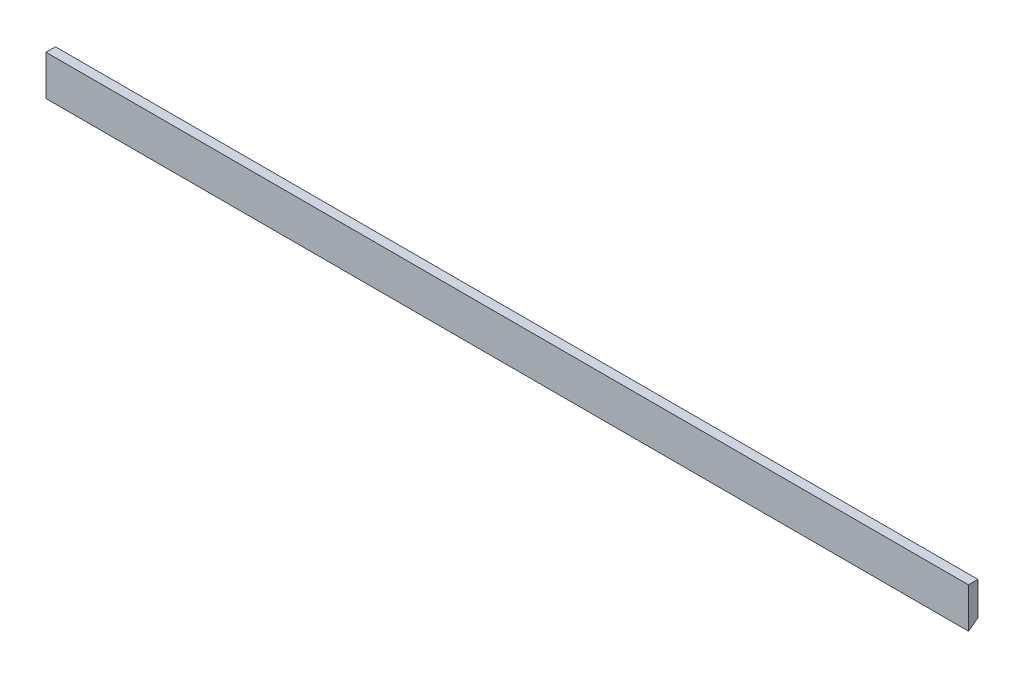
from build123d import *

# Parameters (mm, degrees)
SKETCH2_W           = 3.175
SKETCH2_H           = 13.49
BOSS_EXTRUDE1_DEPTH = 310
CHAMFER1_SIZE       = 2.349376413
CHAMFER1_SIZE_2     = 3.175


with BuildPart() as part:
    # Sketch2 → Boss-Extrude1 (new body)
    with BuildSketch(Plane(origin=(0, 0, 0), x_dir=(0, 0, -1), z_dir=(1, 0, 0))):
        Rectangle(SKETCH2_W, SKETCH2_H)
    extrude(amount=BOSS_EXTRUDE1_DEPTH)

    # Chamfer1
    # the kernel refuses this chamfer: 3.175, 2.349376413 mm, written as the material it takes off along each edge
    with BuildSketch(Plane(origin=(-8.194900993, -6.745, -1.5875), x_dir=(0, 0.9991149585695113, -0.0420630427173772), z_dir=(1, 0, 0))) as chamfer1_piece_1:
        Polygon((CHAMFER1_SIZE * 0.999114958661, CHAMFER1_SIZE * 0.0420630427212), (-CHAMFER1_SIZE_2 * 0.0420630427174, CHAMFER1_SIZE_2 * 0.99911495857), (0, 0), align=None)
    extrude(amount=326.389801986, mode=Mode.SUBTRACT)


solid = part.part
